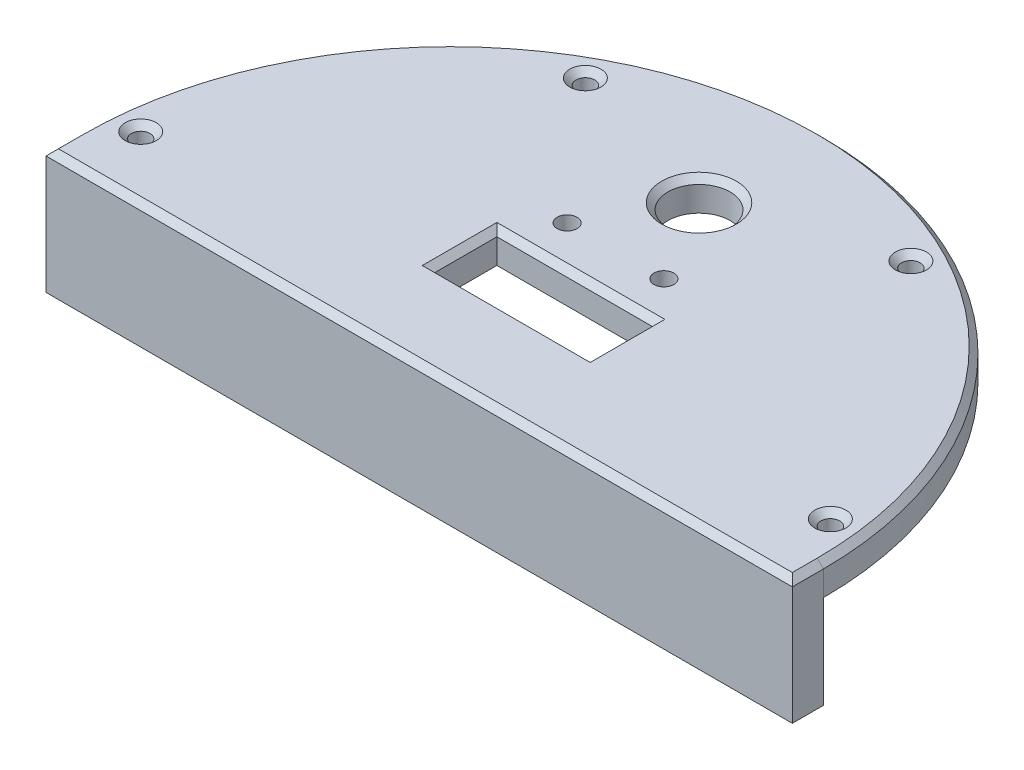
from build123d import *

# Parameters (mm, degrees)
BOSS_EXTRUDE1_DEPTH = 5
SKETCH2_R           = 1.5
CUT_EXTRUDE1_DEPTH  = 5
CIRPATTERN1_COUNT   = 4
CIRPATTERN1_ANGLE   = 168
SKETCH8_W           = 25
SKETCH8_H           = 10
CUT_EXTRUDE3_DEPTH  = 5
SKETCH9_W           = 120
SKETCH9_H           = 20
BOSS_EXTRUDE5_DEPTH = 5
SKETCH10_R          = 5
CUT_EXTRUDE4_DEPTH  = 10
CHAMFER1_SIZE       = 1
CHAMFER2_SIZE       = 1
SKETCH5_R           = 1.6
CUT_EXTRUDE5_DEPTH  = 10
BOSS_EXTRUDE6_START = 1
SKETCH11_R          = 2.5
SKETCH11_R_2        = 1.6
BOSS_EXTRUDE6_DEPTH = 1
FILLET5_R           = 1


with BuildPart() as part:
    # Sketch1 → Boss-Extrude1 (new body)
    with BuildSketch(Plane(origin=(0, 0, 0), x_dir=(1, 0, 0), z_dir=(0, 1, 0))):
        with BuildLine():
            Line((-60, 0), (-25.75, 0))
            Line((-25.75, 0), (25.75, 0))
            Line((25.75, 0), (60, 0))
            ThreePointArc((60, 0), (0, 60), (-60, 0))
        make_face()
    extrude(amount=BOSS_EXTRUDE1_DEPTH)

    # Sketch2 → Cut-Extrude1 (cut)
    with BuildSketch(Plane(origin=(0, 5, 0), x_dir=(1, 0, 0), z_dir=(0, 1, 0))):
        with Locations(Location((-54.772255751, 5, 0), (0, 0, 270))):
            Circle(SKETCH2_R)
    cut_extrude1 = extrude(amount=-CUT_EXTRUDE1_DEPTH, mode=Mode.SUBTRACT)

    # CirPattern1: Cut-Extrude1 ×4 about axis
    cirpattern1_axis = Axis((0, 0, 0), (0, -1, 0))
    for i in range(1, CIRPATTERN1_COUNT):
        add(cut_extrude1.rotate(cirpattern1_axis, i * CIRPATTERN1_ANGLE / (CIRPATTERN1_COUNT - 1)), mode=Mode.SUBTRACT)

    # Sketch8 → Cut-Extrude3 (cut, symmetric)
    with BuildSketch(Plane(origin=(0, 0, 0), x_dir=(-1, 0, 0), z_dir=(0, -1, 0))):
        with Locations((0, 15)):
            Rectangle(SKETCH8_W, SKETCH8_H)
    extrude(amount=CUT_EXTRUDE3_DEPTH, both=True, mode=Mode.SUBTRACT)

    # Sketch9 → Boss-Extrude5 (add)
    with BuildSketch(Plane.XY):
        with Locations((0, -5)):
            Rectangle(SKETCH9_W, SKETCH9_H)
    extrude(amount=BOSS_EXTRUDE5_DEPTH)

    # Sketch10 → Cut-Extrude4 (cut)
    with BuildSketch(Plane(origin=(0, 5, 0), x_dir=(1, 0, 0), z_dir=(0, 1, 0))):
        with Locations(Location((0, 40, 0), (0, 0, 270))):
            Circle(SKETCH10_R)
    extrude(amount=-CUT_EXTRUDE4_DEPTH, mode=Mode.SUBTRACT)

    # Chamfer1
    chamfer1_edges = [part.edges().sort_by_distance(p)[0] for p in [
        (-54.772255751, 5, -6.5),
        (-25.239512501, 5, -49.043011823),
        (26.544743195, 5, -48.349008353),
        (54.926776539, 5, -5.029832898),
        (-12.5, 5, -15),
        (0, 5, -10),
        (12.5, 5, -15),
        (0, 5, -20),
        (0, 5, -45),
    ]]
    chamfer(chamfer1_edges, length=CHAMFER1_SIZE)

    # Chamfer2
    chamfer2_edges = [part.edges().sort_by_distance(p)[0] for p in [
        (0, 5, -60),
        (-60, 5, 2.5),
        (60, 5, 2.5),
        (0, 5, 5),
    ]]
    chamfer(chamfer2_edges, length=CHAMFER2_SIZE)

    # Sketch5 → Cut-Extrude5 (cut)
    with BuildSketch(Plane.XZ):
        with Locations(Location((-7.785, -26.572067281, 0), (0, 0, 270))):
            Circle(SKETCH5_R)
        with Locations(Location((7.775, -26.572067281, 0), (0, 0, 270))):
            Circle(SKETCH5_R)
    extrude(amount=-CUT_EXTRUDE5_DEPTH, mode=Mode.SUBTRACT)

    # Sketch11 → Boss-Extrude6 (add)
    # profile 1 of 2: a face of its own
    with BuildSketch(Plane.XZ.offset(BOSS_EXTRUDE6_START)):
        with Locations(Location((-7.785, -26.572067281, 0), (0, 0, 90))):
            Circle(SKETCH11_R)
        with Locations(Location((-7.785, -26.572067281, 0), (0, 0, 270))):
            Circle(SKETCH11_R_2, mode=Mode.SUBTRACT)
    # profile 2 of 2: a face of its own
    with BuildSketch(Plane.XZ.offset(BOSS_EXTRUDE6_START)):
        with Locations(Location((7.775, -26.572067281, 0), (0, 0, 90))):
            Circle(SKETCH11_R)
        with Locations(Location((7.775, -26.572067281, 0), (0, 0, 270))):
            Circle(SKETCH11_R_2, mode=Mode.SUBTRACT)
    extrude(amount=-BOSS_EXTRUDE6_DEPTH)

    # Fillet5
    fillet5_edges = [part.edges().sort_by_distance(p)[0] for p in [
        (-7.785, 0, -29.072067281),
        (7.775, 0, -29.072067281),
    ]]
    fillet(fillet5_edges, radius=FILLET5_R - 0.0001)  # a hair under: the kernel refuses the full size


solid = part.part
